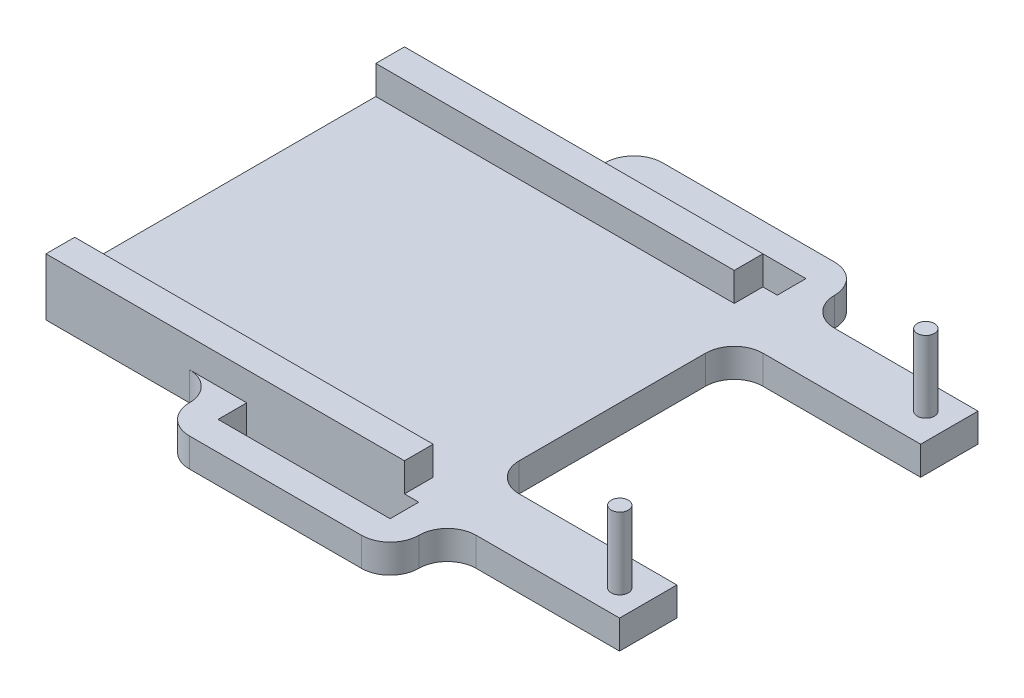
from build123d import *

# Parameters (mm, degrees)
SKETCH1_W           = 40
SKETCH1_H           = 25
BOSS_EXTRUDE1_DEPTH = 2
SKETCH2_W           = 25
SKETCH2_H           = 2
BOSS_EXTRUDE2_DEPTH = 2
SKETCH3_W           = 13
SKETCH3_H           = 17
CUT_EXTRUDE1_DEPTH  = 3
SKETCH4_R           = 0.6
BOSS_EXTRUDE3_DEPTH = 5
SKETCH5_W           = 16
SKETCH5_H           = 2
BOSS_EXTRUDE4_DEPTH = 4
SKETCH6_W           = 12
SKETCH6_H           = 2
CUT_EXTRUDE2_DEPTH  = 4
FILLET1_START       = -1
FILLET1_DEPTH       = 4
FILLET1_2_DEPTH     = 2
MIRROR4_DEPTH       = 2
FILLET2_R           = 2
FILLET3_R           = 2


with BuildPart() as part:
    # Sketch1 → Boss-Extrude1 (new body)
    with BuildSketch(Plane(origin=(0, 0, 0), x_dir=(1, 0, 0), z_dir=(0, 1, 0))):
        Rectangle(SKETCH1_W, SKETCH1_H)
    extrude(amount=BOSS_EXTRUDE1_DEPTH)

    # Sketch2 → Boss-Extrude2 (add)
    with BuildSketch(Plane(origin=(0, 2, 0), x_dir=(1, 0, 0), z_dir=(0, 1, 0))):
        with Locations((-7.5, 11.5)):
            Rectangle(SKETCH2_W, SKETCH2_H)
    boss_extrude2 = extrude(amount=BOSS_EXTRUDE2_DEPTH)

    # Mirror1: Boss-Extrude2 across plane
    add(boss_extrude2.mirror(Plane.XY))

    # Sketch3 → Cut-Extrude1 (cut)
    with BuildSketch(Plane(origin=(0, 2, 0), x_dir=(1, 0, 0), z_dir=(0, 1, 0))):
        with Locations((13.5, 0)):
            Rectangle(SKETCH3_W, SKETCH3_H)
    extrude(amount=-CUT_EXTRUDE1_DEPTH, mode=Mode.SUBTRACT)

    # Sketch4 → Boss-Extrude3 (add)
    with BuildSketch(Plane(origin=(0, 2, 0), x_dir=(1, 0, 0), z_dir=(0, 1, 0))):
        with Locations(Location((18.188184095, -10.67, 0), (0, 0, 270))):
            Circle(SKETCH4_R)
    boss_extrude3 = extrude(amount=BOSS_EXTRUDE3_DEPTH)

    # Mirror2: Boss-Extrude3 across plane
    add(boss_extrude3.mirror(Plane.XY))

    # Sketch5 → Boss-Extrude4 (add)
    with BuildSketch(Plane.XY.offset(12.5)):
        with Locations((0, 1)):
            Rectangle(SKETCH5_W, SKETCH5_H)
    extrude(amount=BOSS_EXTRUDE4_DEPTH)

    # Sketch6 → Cut-Extrude2 (cut)
    with BuildSketch(Plane(origin=(0, 2, 0), x_dir=(1, 0, 0), z_dir=(0, 1, 0))):
        with Locations((0, -13.5)):
            Rectangle(SKETCH6_W, SKETCH6_H)
    extrude(amount=-CUT_EXTRUDE2_DEPTH, mode=Mode.SUBTRACT)

    # Fillet1: read off the stored shape, not the designer's step
    # Fillet1 outline → Fillet1 (cut)
    with BuildSketch(Plane(origin=(0, 0, 0), x_dir=(1, 0, 0), z_dir=(0, 1, 0)).offset(FILLET1_START)):
        with BuildLine():
            ThreePointArc((8, -14.5), (7.414213562, -15.914213562), (6, -16.5))
            Line((6, -16.5), (8, -16.5))
            Line((8, -16.5), (8, -14.5))
        make_face()
        with BuildLine():
            Line((-8, -16.5), (-6, -16.5))
            ThreePointArc((-6, -16.5), (-7.414213562, -15.914213562), (-8, -14.5))
            Line((-8, -14.5), (-8, -16.5))
        make_face()
    extrude(amount=FILLET1_DEPTH, mode=Mode.SUBTRACT)

    # Fillet1 2 outline → Fillet1 2 (add)
    with BuildSketch(Plane(origin=(0, 0, 0), x_dir=(1, 0, 0), z_dir=(0, 1, 0))):
        with BuildLine():
            Line((8, -12.5), (8, -14.5))
            ThreePointArc((8, -14.5), (8.585786438, -13.085786438), (10, -12.5))
            Line((10, -12.5), (8, -12.5))
        make_face()
        with BuildLine():
            ThreePointArc((-10, -12.5), (-8.585786438, -13.085786438), (-8, -14.5))
            Line((-8, -14.5), (-8, -12.5))
            Line((-8, -12.5), (-10, -12.5))
        make_face()
    extrude(amount=FILLET1_2_DEPTH)

    # Mirror4: read off the stored shape, not the designer's step
    # Mirror4 outline → Mirror4 (add)
    with BuildSketch(Plane(origin=(0, 0, 0), x_dir=(1, 0, 0), z_dir=(0, 1, 0))):
        with BuildLine():
            Line((-8, 12.5), (-6, 12.5))
            Line((-6, 12.5), (-6, 14.5))
            Line((-6, 14.5), (6, 14.5))
            Line((6, 14.5), (6, 12.5))
            Line((6, 12.5), (8, 12.5))
            Line((8, 12.5), (8, 14.5))
            ThreePointArc((8, 14.5), (7.414213562, 15.914213562), (6, 16.5))
            Line((6, 16.5), (-6, 16.5))
            ThreePointArc((-6, 16.5), (-7.414213562, 15.914213562), (-8, 14.5))
            Line((-8, 14.5), (-8, 12.5))
        make_face()
    extrude(amount=MIRROR4_DEPTH)

    # Fillet2
    # the kernel refuses this fillet: 2 mm, written as the material it adds along each edge
    with BuildSketch(Plane(origin=(-8, 0, -12.5), x_dir=(-1, 0, 0), z_dir=(0, 1, 0))) as fillet2_piece_1:
        with BuildLine():
            CenterArc((FILLET2_R, -FILLET2_R), FILLET2_R, 90, 90)
            Line((0, -FILLET2_R), (0, 0))
            Line((0, 0), (FILLET2_R, 0))
        make_face()
    extrude(amount=2)
    with BuildSketch(Plane(origin=(8, 0, -12.5), x_dir=(1, 0, 0), z_dir=(0, 1, 0))) as fillet2_piece_2:
        with BuildLine():
            CenterArc((FILLET2_R, FILLET2_R), FILLET2_R, 180, 90)
            Line((0, FILLET2_R), (0, 0))
            Line((0, 0), (FILLET2_R, 0))
        make_face()
    extrude(amount=2)

    # Fillet3
    fillet3_edges = [part.edges().sort_by_distance(p)[0] for p in [
        (7, 1, 8.5),
        (7, 1, -8.5),
    ]]
    fillet(fillet3_edges, radius=FILLET3_R)


solid = part.part
